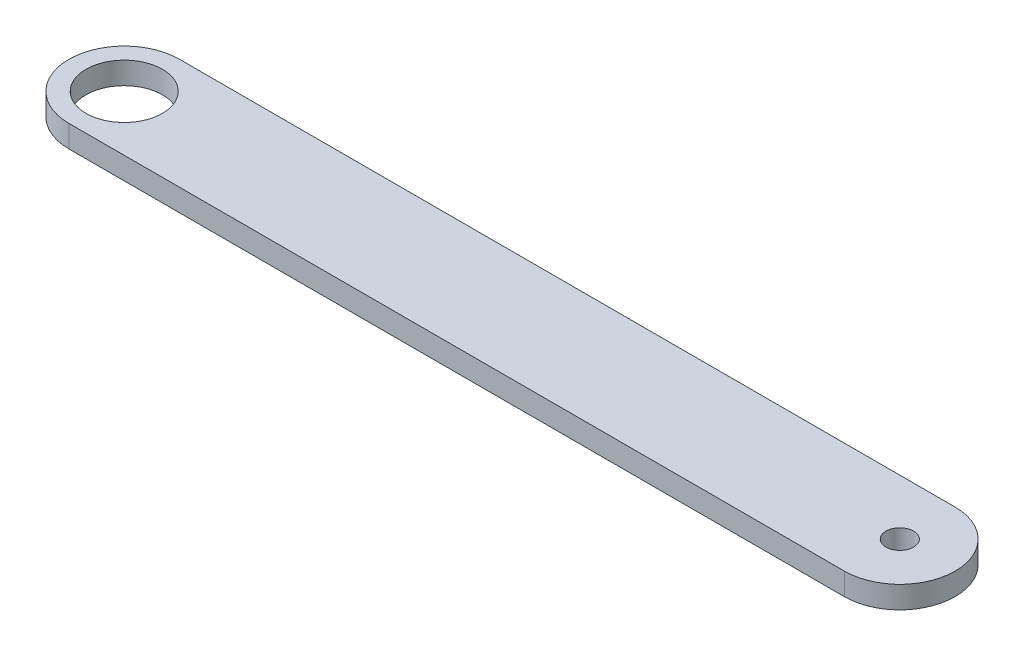
from build123d import *

# Parameters (mm, degrees)
SKETCH1_R           = 2.5
SKETCH1_R_2         = 6.9
BOSS_EXTRUDE1_DEPTH = 4


with BuildPart() as part:
    # Sketch1 → Boss-Extrude1 (new body)
    with BuildSketch(Plane(origin=(0, 0, 0), x_dir=(1, 0, 0), z_dir=(0, 1, 0))):
        with BuildLine():
            Line((140, 10), (0, 10))
            ThreePointArc((0, 10), (-10, 0), (0, -10))
            Line((0, -10), (140, -10))
            ThreePointArc((140, -10), (150, 0), (140, 10))
        make_face()
        with Locations((140, 0)):
            Circle(SKETCH1_R, mode=Mode.SUBTRACT)
        Circle(SKETCH1_R_2, mode=Mode.SUBTRACT)
    extrude(amount=BOSS_EXTRUDE1_DEPTH)


solid = part.part
